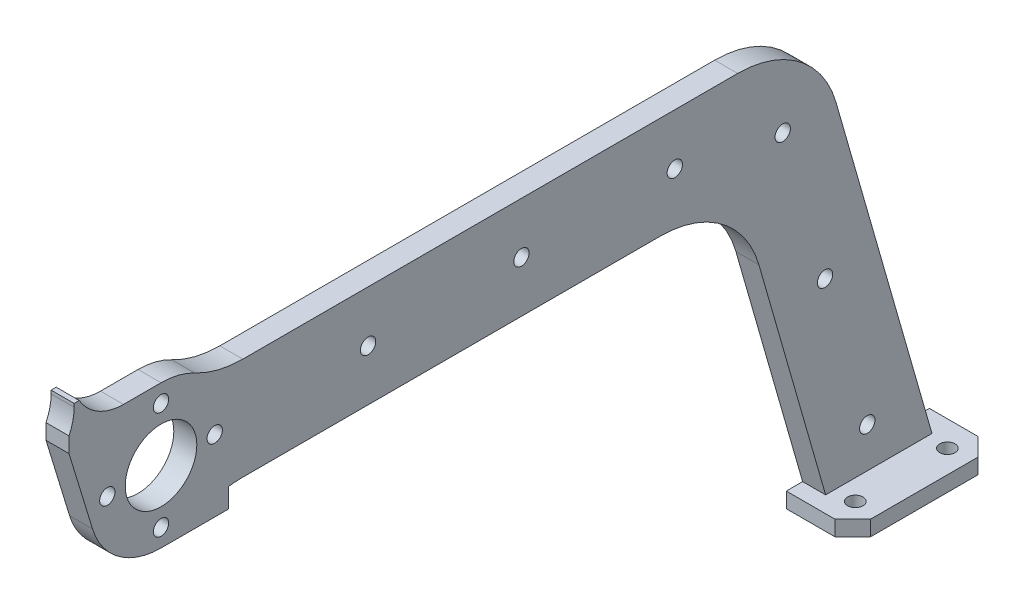
from build123d import *

# Parameters (mm, degrees)
SKETCH_1_R          = 1.5
SKETCH_1_R_2        = 7
EXTRUDE_1_DEPTH     = 2.25
SKETCH_5_W          = 13
SKETCH_5_H          = 28
EXTRUDE_3_DEPTH     = 3
SKETCH_6_R          = 1.5
CUT_EXTRUDE_2_DEPTH = 177.455253939
SKETCH_7_W          = 0.998721622
SKETCH_7_H          = 4.998741363
EXTRUDE_4_DEPTH     = 4.5
FILLET_1_R          = 10
CHAMFER_1_SIZE      = 3.5


with BuildPart() as part:
    # 草图1 → 凸台-拉伸1 (new, symmetric)
    with BuildSketch(Plane(origin=(0, 0, 0), x_dir=(0, 0, -1), z_dir=(1, 0, 0))):
        with BuildLine():
            ThreePointArc((97.745383074, -10), (109.768953128, -14.033657178), (116.949426552, -24.487241658))
            Line((116.949426552, -24.487241658), (130, -70))
            Line((130, -70), (150.805988717, -70))
            Line((150.805988717, -70), (132.020510773, -4.487252884))
            ThreePointArc((132.020510773, -4.487252884), (124.831577318, 5.972710201), (112.795276854, 10))
            Line((112.795276854, 10), (16, 10))
            ThreePointArc((16, 10), (11.149287499, 10.597149997), (6.588235294, 12.352941176))
            ThreePointArc((6.588235294, 12.352941176), (3.395498751, 13.581995002), (0, 14))
            Line((0, 14), (-18, 14))
            Line((-18, 14), (-18, 11))
            Line((-18, 11), (-13.388941598, -4.090995342))
            ThreePointArc((-13.388941598, -4.090995342), (-8.328447191, -11.253309175), (0, -14))
            Line((0, -14), (13.224243357, -14))
            Line((13.224243357, -14), (13.224243357, -10.193557234))
            ThreePointArc((13.224243357, -10.193557234), (14.608751519, -10.048447989), (16, -10))
            Line((16, -10), (97.745383074, -10))
        make_face()
        with Locations((138.148241349, -62.136741787)):
            Circle(SKETCH_1_R, mode=Mode.SUBTRACT)
        with Locations((129.879120675, -33.298890909)):
            Circle(SKETCH_1_R, mode=Mode.SUBTRACT)
        with Locations((0, -10.5)):
            Circle(SKETCH_1_R, mode=Mode.SUBTRACT)
        with Locations((-10.5, 0)):
            Circle(SKETCH_1_R, mode=Mode.SUBTRACT)
        Circle(SKETCH_1_R_2, mode=Mode.SUBTRACT)
        with Locations((10.5, 0)):
            Circle(SKETCH_1_R, mode=Mode.SUBTRACT)
        with Locations((0, 10.5)):
            Circle(SKETCH_1_R, mode=Mode.SUBTRACT)
        with Locations((40.5, 0)):
            Circle(SKETCH_1_R, mode=Mode.SUBTRACT)
        with Locations((70.5, 0)):
            Circle(SKETCH_1_R, mode=Mode.SUBTRACT)
        with Locations((100.5, 0)):
            Circle(SKETCH_1_R, mode=Mode.SUBTRACT)
        with Locations((121.61, -4.461040031)):
            Circle(SKETCH_1_R, mode=Mode.SUBTRACT)
    extrude(amount=EXTRUDE_1_DEPTH, both=True)

    # 草图5 → 凸台-拉伸3 (add)
    with BuildSketch(Plane.XZ.offset(70)):
        with Locations((4.25, -140.805988717)):
            Rectangle(SKETCH_5_W, SKETCH_5_H)
    extrude(amount=EXTRUDE_3_DEPTH)

    # 草图6 → 切除-拉伸2 (cut, through all)
    with BuildSketch(Plane(origin=(0, -70, 0), x_dir=(1, 0, 0), z_dir=(0, 1, 0))):
        with Locations(Location((6.25, 149.805988717, 0), (0, 0, 270))):
            Circle(SKETCH_6_R)
        with Locations(Location((6.25, 131.805988717, 0), (0, 0, 90))):
            Circle(SKETCH_6_R)
    extrude(amount=-CUT_EXTRUDE_2_DEPTH, mode=Mode.SUBTRACT)

    # 草图7 → 凸台-拉伸4 (add)
    with BuildSketch(Plane(origin=(2.25, 0, 0), x_dir=(0, 0, -1), z_dir=(1, 0, 0))):
        with Locations((-16.501706932, 16.499370682)):
            Rectangle(SKETCH_7_W, SKETCH_7_H)
    extrude(amount=-EXTRUDE_4_DEPTH)

    # 圆角1
    # the kernel refuses this fillet: 10 mm, written as the material it adds along each edge
    with BuildSketch(Plane(origin=(2.25, 14, 16.002346121), x_dir=(0, 0, -1), z_dir=(-1, 0, 0))) as fillet_1_piece_1:
        with BuildLine():
            CenterArc((8.659527241, -10), FILLET_1_R, 90, 59.991672573)
            Line((0, -4.998741363), (-0.173190545, -4.89871619))
            ThreePointArc((-0.173190545, -4.89871619), (-0.2, -2.499370681), (-0.2, 0))
            Line((-0.2, 0), (0, 0.2))
            Line((0, 0.2), (8.659527241, 0.2))
            Line((8.659527241, 0.2), (8.659527241, 0))
        make_face()
    extrude(amount=4.5)
    with BuildSketch(Plane(origin=(2.25, 14, 17.001067743), x_dir=(0, 0, 1), z_dir=(-1, 0, 0))) as fillet_1_piece_2:
        with BuildLine():
            CenterArc((10, 4.356693642), FILLET_1_R, 180, 25.82789421)
            Line((0, 4.356693642), (-0.2, 4.356693642))
            Line((-0.2, 4.356693642), (-0.2, 0))
            Line((-0.2, 0), (0, -0.2))
            ThreePointArc((0, -0.2), (0.499466129, -0.2), (0.818910902, -0.087133873))
            Line((0.818910902, -0.087133873), (0.998932257, 0))
        make_face()
    extrude(amount=4.5)

    # 倒角1
    chamfer_1_edges = [part.edges().sort_by_distance(p)[0] for p in [
        (10.75, -71.5, -154.805988717),
        (10.75, -71.5, -126.805988717),
    ]]
    chamfer(chamfer_1_edges, length=CHAMFER_1_SIZE)


solid = part.part
